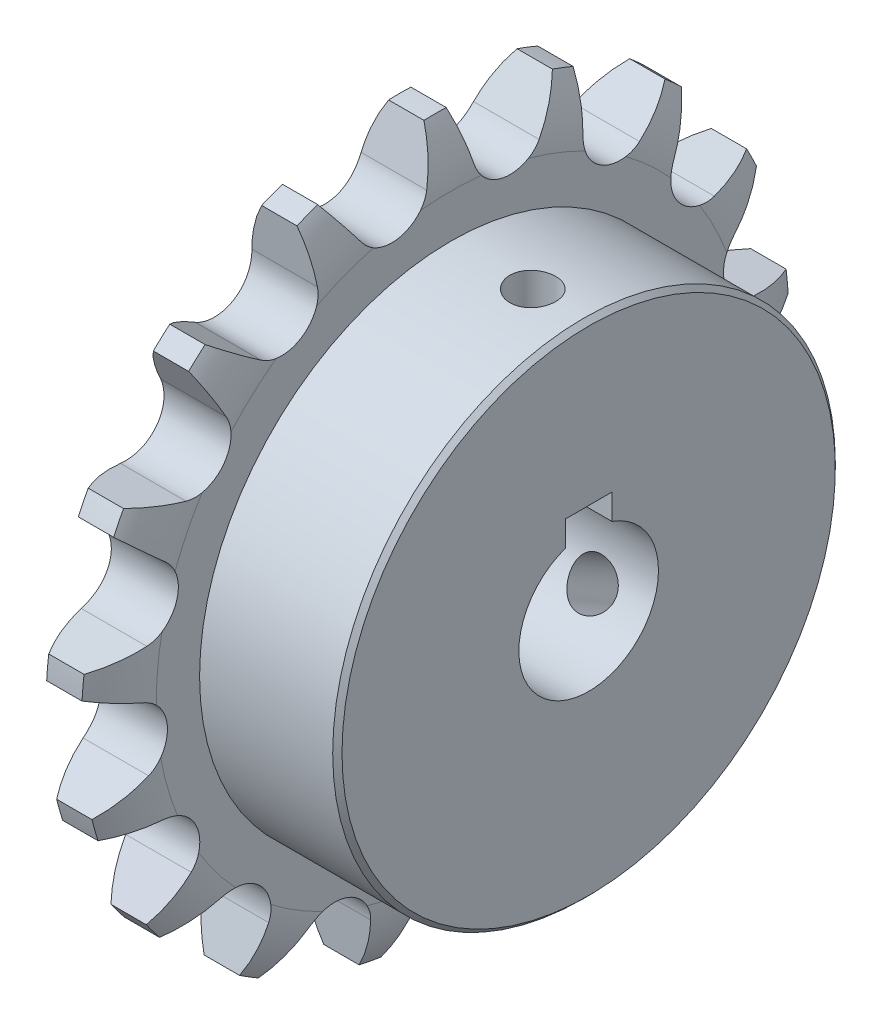
from build123d import *

# Parameters (mm, degrees)
CHAMFER1_SIZE      = 0.5
CUT_EXTRUDE1_DEPTH = 59.068924564
CIRPATTERN1_COUNT  = 17
TAP1_D             = 4.917
TAP1_DEPTH         = 26.999
TAP1_TIP           = 1.477215832
TAP2_D             = 4.917
TAP2_DEPTH         = 26.999
TAP2_TIP           = 1.477215832
SKETCH8_W          = 5
SKETCH8_H          = 9.8
CUT_EXTRUDE2_DEPTH = 59.022778511


with BuildPart() as part:
    # Sketch1 → Revolve1 (revolve)
    with BuildSketch(Plane.XY):
        with BuildLine():
            Line((0, 7.5), (22, 7.5))
            Line((22, 7.5), (22, 27))
            Line((22, 27), (7.2, 27))
            Line((7.2, 27), (7.2, 31.649915551))
            ThreePointArc((7.2, 31.649915551), (6.767252239, 34.936961138), (5.4985, 38))
            Line((5.4985, 38), (1.7015, 38))
            ThreePointArc((1.7015, 38), (0.432747761, 34.936961138), (0, 31.649915551))
            Line((0, 31.649915551), (0, 7.5))
        make_face()
    revolve(axis=Axis((0, 0, 0), (1, 0, 0)))

    # Chamfer1
    chamfer1_edges = [part.edges().sort_by_distance(p)[0] for p in [
        (22, -27, 0),
    ]]
    chamfer(chamfer1_edges, length=CHAMFER1_SIZE)

    # Sketch2 → Cut-Extrude1 (cut, through all)
    with BuildSketch(Plane(origin=(0, 0, 0), x_dir=(0, 0, -1), z_dir=(1, 0, 0))):
        with BuildLine():
            Line((-2.521781371, 32.959914525), (-1.195, 37.98120555))
            ThreePointArc((-1.195, 37.98120555), (-6.982481677, 37.352977788), (-12.606089662, 35.848103205))
            Line((-12.606089662, 35.848103205), (-9.555003344, 31.645177482))
            ThreePointArc((-9.555003344, 31.645177482), (-5.622735245, 30.07897685), (-2.521781371, 32.959914525))
        make_face()
    cut_extrude1 = extrude(amount=CUT_EXTRUDE1_DEPTH, mode=Mode.SUBTRACT)

    # CirPattern1: Cut-Extrude1 ×17 about axis
    cirpattern1_axis = Axis((0, 0, 0), (-1, 0, 0))
    for i in range(1, CIRPATTERN1_COUNT):
        add(cut_extrude1.rotate(cirpattern1_axis, i * 360 / CIRPATTERN1_COUNT), mode=Mode.SUBTRACT)

    # Tap1
    with Locations(Plane(origin=(0, 27, 0), x_dir=(1, 0, 0), z_dir=(0, 1, 0))):
        with Locations((16, 0)):
            Hole(TAP1_D / 2, depth=TAP1_DEPTH)
            with Locations((0, 0, -(TAP1_DEPTH + TAP1_TIP / 2))):  # 118° drill point
                Cone(0, TAP1_D / 2, TAP1_TIP, mode=Mode.SUBTRACT)

    # Tap2
    with Locations(Plane(origin=(0, -13.5, -23.382685902), x_dir=(1, 0, 0), z_dir=(0, -0.49999999999999495, -0.8660254037844416))):
        with Locations((16, 0)):
            Hole(TAP2_D / 2, depth=TAP2_DEPTH)
            with Locations((0, 0, -(TAP2_DEPTH + TAP2_TIP / 2))):  # 118° drill point
                Cone(0, TAP2_D / 2, TAP2_TIP, mode=Mode.SUBTRACT)

    # Sketch8 → Cut-Extrude2 (cut, through all)
    with BuildSketch(Plane(origin=(22, 0, 0), x_dir=(0, 0, -1), z_dir=(1, 0, 0))):
        with Locations((0, 4.9)):
            Rectangle(SKETCH8_W, SKETCH8_H)
    extrude(amount=-CUT_EXTRUDE2_DEPTH, mode=Mode.SUBTRACT)


solid = part.part
